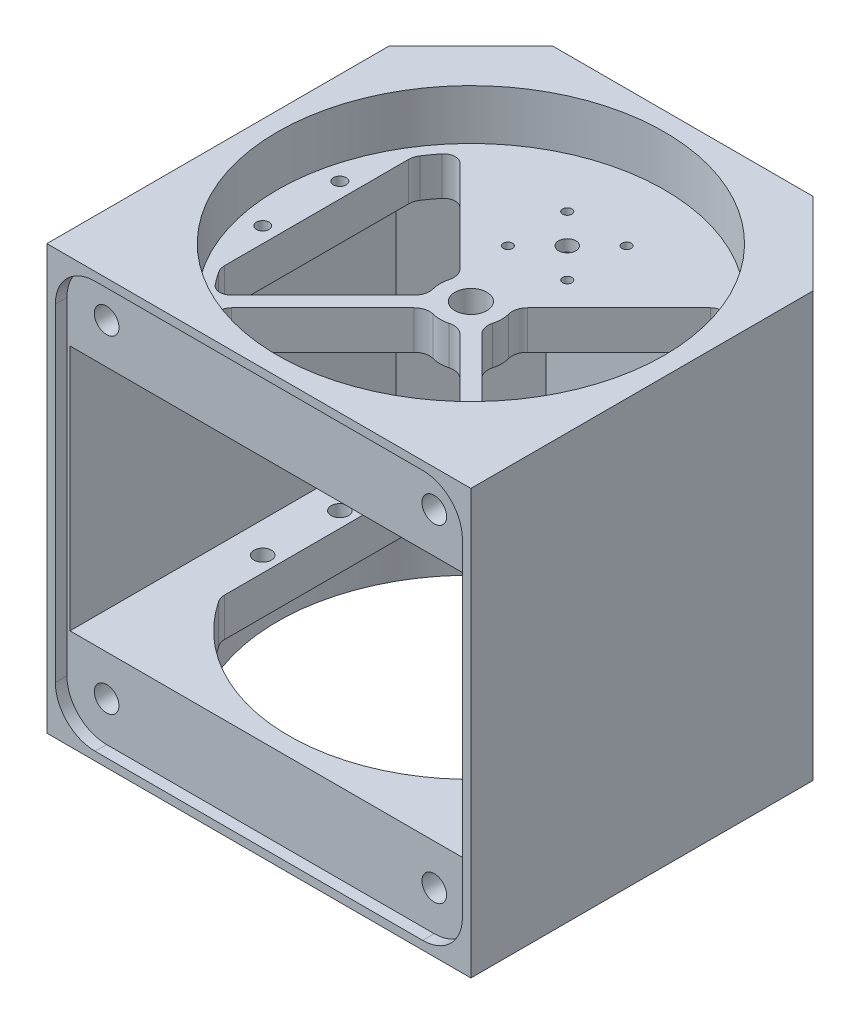
from build123d import *

# Parameters (mm, degrees)
BOSS_EXTRUDE1_DEPTH  = 3
BOSS_EXTRUDE2_REACH  = 125.02
SKETCH3_R            = 50.2
BOSS_EXTRUDE3_DEPTH  = 3
SKETCH4_R            = 50.2
BOSS_EXTRUDE5_DEPTH  = 10
SKETCH5_R            = 47.199999999999996
BOSS_EXTRUDE6_DEPTH  = 2
BOSS_EXTRUDE14_DEPTH = 20
SKETCH12_R           = 47.2
BOSS_EXTRUDE16_DEPTH = 8
SKETCH13_R           = 3.20000000000001
SKETCH13_R_2         = 3.2000000000000037
CUT_EXTRUDE2_DEPTH   = 15
SKETCH14_R           = 4.15
BOSS_EXTRUDE17_DEPTH = 10
FILLET1_R            = 3
FILLET2_R            = 4
SKETCH15_R           = 1.6500000000000017
BOSS_EXTRUDE18_DEPTH = 10
FILLET3_R            = 4
FILLET4_R            = 3
FILLET5_R            = 4
FILLET6_R            = 4
BOSS_EXTRUDE19_DEPTH = 5
SKETCH17_R           = 2.2500000000000004
SKETCH17_R_2         = 1.2000000000000048
SKETCH17_R_3         = 1.200000000000003
CUT_EXTRUDE3_DEPTH   = 154.58710883404248
SKETCH18_R           = 8.2
CUT_EXTRUDE4_DEPTH   = 2
CUT_EXTRUDE5_DEPTH   = 10
SKETCH23_R           = 2.2500000000000027
CUT_EXTRUDE6_DEPTH   = 10


with BuildPart() as part:
    # Sketch1 → Boss-Extrude1 (new body)
    with BuildSketch(Plane.XY):
        Polygon((54.99999999999996, 55), (-55.00000000000002, 54.99999999999997), (-55.00000000000001, -55.00000000000003), (54.99999999999999, -55), align=None)
        with BuildLine():
            Line((52.79999999999999, -42.500000000000014), (52.800000000000004, 42.49999999999998))
            ThreePointArc((52.800000000000004, 42.49999999999998), (49.78319984622145, 49.78319984622142), (42.50000000000001, 52.79999999999998))
            Line((42.50000000000001, 52.79999999999998), (-42.499999999999986, 52.79999999999999))
            ThreePointArc((-42.499999999999986, 52.79999999999999), (-49.78319984622143, 49.78319984622143), (-52.79999999999999, 42.499999999999986))
            Line((-52.79999999999999, 42.499999999999986), (-52.800000000000004, -42.5))
            ThreePointArc((-52.800000000000004, -42.5), (-49.78319984622144, -49.783199846221436), (-42.5, -52.8))
            Line((-42.5, -52.8), (42.499999999999986, -52.80000000000001))
            ThreePointArc((42.499999999999986, -52.80000000000001), (49.78319984622143, -49.78319984622145), (52.79999999999999, -42.500000000000014))
        make_face(mode=Mode.SUBTRACT)
    extrude(amount=-BOSS_EXTRUDE1_DEPTH)

    # Boss-Extrude2: up to this face of the body (flat: up to its plane)
    boss_extrude2_end = Plane(part.part.faces().sort_by_distance((0, 55, -1.5))[0])
    # Sketch2 → Boss-Extrude2 (add, up to the picked face)
    with BuildSketch(Plane.XZ.offset(55.000000000000014), mode=Mode.PRIVATE) as boss_extrude2_sk1:
        Polygon((54.99999999999998, -3), (54.99999999999999, -88.78679656440359), (33.786796564403566, -110), (-33.78679656440356, -110), (-55.00000000000002, -88.78679656440362), (-55.00000000000002, -3), (-52.00000000000002, -3.0000000000000027), (-52.00000000000002, -87.54415587728425), (-32.54415587728427, -107), (32.5441558772843, -107), (51.99999999999998, -87.54415587728431), (51.99999999999998, -3), align=None)
    boss_extrude2_tool1 = split(extrude(boss_extrude2_sk1.sketch, amount=-BOSS_EXTRUDE2_REACH, mode=Mode.PRIVATE), bisect_by=boss_extrude2_end, keep=Keep.BOTH, mode=Mode.PRIVATE)
    add(boss_extrude2_tool1.solids().sort_by(Axis((53.465432, -55, -45.893398), (-2.5e-16, 1, 0)))[0])

    # Sketch3 → Boss-Extrude3 (add)
    with BuildSketch(Plane.XZ.offset(55.000000000000014)):
        Polygon((-52.00000000000002, -3.0000000000000027), (-52.00000000000002, -87.54415587728425), (-32.54415587728427, -107), (32.5441558772843, -107), (51.99999999999998, -87.54415587728431), (51.99999999999998, -3), align=None)
        with Locations((0, -55)):
            Circle(SKETCH3_R, mode=Mode.SUBTRACT)
    boss_extrude3 = extrude(amount=-BOSS_EXTRUDE3_DEPTH)

    # Sketch4 → Boss-Extrude5 (add)
    with BuildSketch(Plane(origin=(1.388e-14, -52.000000000000014, 0), x_dir=(1, 2.7e-16, 0), z_dir=(-2.7e-16, 1, 0))):
        with BuildLine():
            Line((11.235657524150534, 3.000000000000002), (-11.235657524150536, 3.0000000000000027))
            ThreePointArc((-11.235657524150536, 3.0000000000000027), (1.431e-14, 108.2), (11.235657524150534, 3.000000000000002))
        make_face()
        with Locations((-7.6e-16, 55)):
            Circle(SKETCH4_R, mode=Mode.SUBTRACT)
    boss_extrude5 = extrude(amount=BOSS_EXTRUDE5_DEPTH)

    # Sketch5 → Boss-Extrude6 (add)
    with BuildSketch(Plane(origin=(1.121e-14, -42.00000000000001, 0), x_dir=(1, 2.7e-16, 0), z_dir=(-2.7e-16, 1, 0))):
        with BuildLine():
            Line((51.99999999999997, 43.76434247584933), (51.99999999999997, 66.23565752415067))
            ThreePointArc((51.99999999999997, 66.23565752415067), (37.61808075912428, 92.61808075912438), (11.235657524150533, 107.00000000000001))
            Line((11.235657524150533, 107.00000000000001), (-11.235657524150534, 107))
            ThreePointArc((-11.235657524150534, 107), (-37.618080759124375, 92.61808075912428), (-52.00000000000003, 66.23565752415041))
            Line((-52.00000000000003, 66.23565752415041), (-52.00000000000003, 43.7643424758496))
            ThreePointArc((-52.00000000000003, 43.7643424758496), (-37.618080759124375, 17.381919240875717), (-11.235657524150529, 2.9999999999999956))
            Line((-11.235657524150529, 2.9999999999999956), (11.23565752415051, 2.9999999999999956))
            ThreePointArc((11.23565752415051, 2.9999999999999956), (37.618080759124275, 17.38191924087561), (51.99999999999997, 43.76434247584933))
        make_face()
        with Locations(Location((-7.6e-16, 55, 0), (0, 0, 180))):
            Circle(SKETCH5_R, mode=Mode.SUBTRACT)
    boss_extrude6 = extrude(amount=BOSS_EXTRUDE6_DEPTH)

    # Sketch11 → Boss-Extrude14 (add)
    with BuildSketch(Plane(origin=(1.388e-14, -52.000000000000014, 0), x_dir=(1, 2.7e-16, 0), z_dir=(-2.7e-16, 1, 0))):
        with BuildLine():
            Line((-52.00000000000002, 43.76434247584956), (-52.00000000000002, 3.0000000000000027))
            Line((-52.00000000000002, 3.0000000000000027), (-46.47994974842644, 3.000000000000002))
            Line((-46.47994974842644, 3.000000000000002), (-11.235657524150511, 3.0000000000000018))
            ThreePointArc((-11.235657524150511, 3.0000000000000018), (-37.61808075912436, 17.381919240875703), (-52.00000000000002, 43.76434247584956))
        make_face()
        with BuildLine():
            Line((-11.235657524150536, 107), (-32.54415587728427, 107))
            Line((-32.54415587728427, 107), (-52.00000000000003, 87.54415587728425))
            Line((-52.00000000000003, 87.54415587728425), (-52.00000000000002, 66.23565752415044))
            ThreePointArc((-52.00000000000002, 66.23565752415044), (-37.61808075912436, 92.6180807591243), (-11.235657524150536, 107))
        make_face()
        with BuildLine():
            Line((51.99999999999998, 66.23565752415062), (51.99999999999998, 87.54415587728431))
            Line((51.99999999999998, 87.54415587728431), (32.5441558772843, 107))
            Line((32.5441558772843, 107), (11.235657524150536, 107))
            ThreePointArc((11.235657524150536, 107), (37.6180807591243, 92.61808075912435), (51.99999999999998, 66.23565752415062))
        make_face()
        with BuildLine():
            Line((11.235657524150534, 3.000000000000002), (46.47994974842649, 3.0000000000000004))
            Line((46.47994974842649, 3.0000000000000004), (51.99999999999998, 3))
            Line((51.99999999999998, 3), (51.99999999999998, 43.764342475849375))
            ThreePointArc((51.99999999999998, 43.764342475849375), (37.6180807591243, 17.38191924087564), (11.235657524150534, 3.000000000000002))
        make_face()
    boss_extrude14 = extrude(amount=BOSS_EXTRUDE14_DEPTH)

    # Sketch12 → Boss-Extrude16 (add)
    with BuildSketch(Plane(origin=(1.068e-14, -40.00000000000001, 0), x_dir=(1, 2.7e-16, 0), z_dir=(-2.7e-16, 1, 0))):
        with BuildLine():
            Line((51.99999999999997, 43.764342475849375), (51.99999999999997, 66.23565752415062))
            ThreePointArc((51.99999999999997, 66.23565752415062), (37.618080759124304, 92.61808075912435), (11.23565752415058, 106.99999999999999))
            Line((11.23565752415058, 106.99999999999999), (-11.235657524150536, 107))
            ThreePointArc((-11.235657524150536, 107), (-37.61808075912436, 92.6180807591243), (-52.00000000000003, 66.23565752415044))
            Line((-52.00000000000003, 66.23565752415044), (-52.00000000000003, 43.76434247584956))
            ThreePointArc((-52.00000000000003, 43.76434247584956), (-37.61808075912437, 17.381919240875696), (-11.235657524150529, 2.999999999999989))
            Line((-11.235657524150529, 2.999999999999989), (11.235657524150508, 3.0000000000000027))
            ThreePointArc((11.235657524150508, 3.0000000000000027), (37.61808075912429, 17.38191924087564), (51.99999999999997, 43.764342475849375))
        make_face()
        with Locations(Location((-7.6e-16, 55, 0), (0, 0, 180))):
            Circle(SKETCH12_R, mode=Mode.SUBTRACT)
    boss_extrude16 = extrude(amount=BOSS_EXTRUDE16_DEPTH)

    # Mirror2: Boss-Extrude3, Boss-Extrude5, Boss-Extrude6, Boss-Extrude14, Boss-Extrude16 across plane
    add(boss_extrude3.mirror(Plane.ZX))
    add(boss_extrude5.mirror(Plane.ZX))
    add(boss_extrude6.mirror(Plane.ZX))
    add(boss_extrude14.mirror(Plane.ZX))
    add(boss_extrude16.mirror(Plane.ZX))

    # Sketch13 → Cut-Extrude2 (cut)
    with BuildSketch(Plane.XY.offset(-3.000000000000048)):
        with Locations((-42.499999999999986, 42.50000000000001)):
            Circle(SKETCH13_R)
        with Locations((-42.49999999999999, -42.499999999999986)):
            Circle(SKETCH13_R_2)
        with Locations((42.49999999999999, -42.50000000000001)):
            Circle(SKETCH13_R_2)
        with Locations((42.500000000000014, 42.49999999999998)):
            Circle(SKETCH13_R_2)
    extrude(amount=-CUT_EXTRUDE2_DEPTH, mode=Mode.SUBTRACT)

    # Sketch14 → Boss-Extrude17 (add)
    with BuildSketch(Plane(origin=(1.121e-14, 42.00000000000001, 0), x_dir=(1, -2.7e-16, 0), z_dir=(2.7e-16, 1, 0))):
        with BuildLine():
            Line((-34.759678021576725, 86.93125089683014), (-6.891439137424786, 59.06301201267851))
            ThreePointArc((-6.891439137424786, 59.06301201267851), (-7.999999999999999, 54.99999999999995), (-6.891439137424732, 50.936987987321395))
            Line((-6.891439137424732, 50.936987987321395), (-34.759678021576356, 23.06874910316946))
            ThreePointArc((-34.759678021576356, 23.06874910316946), (-33.37544007200486, 21.62455992799478), (-31.93125089683014, 20.240321978423275))
            Line((-31.93125089683014, 20.240321978423275), (-4.063012012678523, 48.108560862575224))
            ThreePointArc((-4.063012012678523, 48.108560862575224), (3.881e-14, 47.00000000000001), (4.06301201267859, 48.10856086257526))
            Line((4.06301201267859, 48.10856086257526), (31.93125089683052, 20.24032197842364))
            ThreePointArc((31.93125089683052, 20.24032197842364), (33.37544007200523, 21.624559927995165), (34.75967802157674, 23.068749103169893))
            Line((34.75967802157674, 23.068749103169893), (6.8914391374247845, 50.936987987321494))
            ThreePointArc((6.8914391374247845, 50.936987987321494), (7.999999999999994, 55.00000000000005), (6.891439137424739, 59.06301201267859))
            Line((6.891439137424739, 59.06301201267859), (34.75967802157636, 86.9312508968305))
            ThreePointArc((34.75967802157636, 86.9312508968305), (33.375440072004835, 88.3754400720052), (31.93125089683011, 89.75967802157672))
            Line((31.93125089683011, 89.75967802157672), (4.063012012678516, 61.89143913742478))
            ThreePointArc((4.063012012678516, 61.89143913742478), (-4.645e-14, 63), (-4.063012012678599, 61.89143913742474))
            Line((-4.063012012678599, 61.89143913742474), (-31.931250896830555, 89.75967802157635))
            ThreePointArc((-31.931250896830555, 89.75967802157635), (-33.375440072005254, 88.37544007200484), (-34.759678021576725, 86.93125089683014))
        make_face()
        with Locations(Location((-7.6e-16, 55, 0), (0, 0, 180))):
            Circle(SKETCH14_R, mode=Mode.SUBTRACT)
    boss_extrude17 = extrude(amount=-BOSS_EXTRUDE17_DEPTH)

    # Fillet1
    # the kernel refuses this fillet: 3 mm, written as the material it adds along each edge
    with BuildSketch(Plane(origin=(-34.759678021576704, 40.000000000000014, -86.93125089683014), x_dir=(-0.6499532804124343, 0, 0.7599741661932433), z_dir=(-2.7e-16, -1, 0))) as fillet1_piece_1:
        with BuildLine():
            CenterArc((3.2430714913870022, -2.998110927308941), FILLET1_R, 87.96659386431453, 96.49532662607197)
            Line((0.25216371595927567, -3.2315004705321977), (0, 0))
            ThreePointArc((0, 0), (1.6747590196221822, 0.02972141033939397), (3.349518039244354, 5e-17))
        make_face()
    extrude(amount=8)
    with BuildSketch(Plane(origin=(-31.931250896830544, 40.000000000000014, -89.75967802157635), x_dir=(0.7599741661932361, 0, -0.6499532804124429), z_dir=(-2.7e-16, -1, 0))) as fillet1_piece_2:
        with BuildLine():
            CenterArc((3.243071491387006, 2.998110927308935), FILLET1_R, 175.53807950961286, 96.49532662607254)
            Line((0.2521637159592789, 3.2315004705322257), (0, 0))
            ThreePointArc((0, 0), (1.674759019622179, -0.02972141033938742), (3.349518039244354, -3e-17))
        make_face()
    extrude(amount=8)
    with BuildSketch(Plane(origin=(31.931250896830118, 40, -89.75967802157672), x_dir=(-0.7599741661932423, 0, -0.6499532804124355), z_dir=(-2.7e-16, -1, 0))) as fillet1_piece_3:
        with BuildLine():
            CenterArc((3.243071491386964, -2.9981109273089364), FILLET1_R, 87.96659386431435, 96.49532662607214)
            Line((0.25216371595923237, -3.2315004705321937), (0, 0))
            ThreePointArc((0, 0), (1.6747590196221533, 0.02972141033940673), (3.3495180392443262, 4e-17))
        make_face()
    extrude(amount=8)
    with BuildSketch(Plane(origin=(34.75967802157638, 40, -86.9312508968305), x_dir=(0.6499532804124455, 0, 0.7599741661932338), z_dir=(-2.7e-16, -1, 0))) as fillet1_piece_4:
        with BuildLine():
            CenterArc((3.243071491386969, 2.9981109273089324), FILLET1_R, 175.53807950961357, 96.49532662607226)
            Line((0.25216371595924175, 3.2315004705321857), (0, 0))
            ThreePointArc((0, 0), (1.6747590196221902, -0.02972141033940014), (3.34951803924434, 1.2e-16))
        make_face()
    extrude(amount=8)
    with BuildSketch(Plane(origin=(34.75967802157676, 40, -23.068749103169893), x_dir=(0.6499532804124305, 0, -0.7599741661932468), z_dir=(-2.7e-16, -1, 0))) as fillet1_piece_5:
        with BuildLine():
            CenterArc((3.243071491386989, -2.9981109273089372), FILLET1_R, 87.96659386431473, 96.49532662607226)
            Line((0.25216371595926346, -3.2315004705322194), (0, 0))
            ThreePointArc((0, 0), (1.6747590196221576, 0.02972141033939562), (3.3495180392443307, 7e-17))
        make_face()
    extrude(amount=8)
    with BuildSketch(Plane(origin=(31.93125089683053, 40, -20.240321978423637), x_dir=(-0.7599741661932353, 0, 0.6499532804124437), z_dir=(-2.7e-16, -1, 0))) as fillet1_piece_6:
        with BuildLine():
            CenterArc((3.2430714913869796, 2.9981109273089372), FILLET1_R, 175.5380795096136, 96.49532662607197)
            Line((0.2521637159592498, 3.2315004705321897), (0, 0))
            ThreePointArc((0, 0), (1.6747590196221802, -0.02972141033940335), (3.349518039244338, -4e-17))
        make_face()
    extrude(amount=8)
    with BuildSketch(Plane(origin=(-31.931250896830132, 40.000000000000014, -20.24032197842327), x_dir=(0.7599741661932465, 0, 0.6499532804124305), z_dir=(-2.7e-16, -1, 0))) as fillet1_piece_7:
        with BuildLine():
            CenterArc((3.2430714913869956, -2.998110927308939), FILLET1_R, 87.96659386431477, 96.49532662607203)
            Line((0.2521637159592676, -3.2315004705322137), (0, 0))
            ThreePointArc((0, 0), (1.6747590196221702, 0.02972141033938877), (3.349518039244335, 1e-17))
        make_face()
    extrude(amount=8)
    with BuildSketch(Plane(origin=(-34.75967802157635, 40.000000000000014, -23.06874910316946), x_dir=(-0.6499532804124424, 0, -0.7599741661932364), z_dir=(-2.7e-16, -1, 0))) as fillet1_piece_8:
        with BuildLine():
            CenterArc((3.24307149138697, 2.9981109273089377), FILLET1_R, 175.53807950961334, 96.49532662607214)
            Line((0.2521637159592439, 3.231500470532203), (0, 0))
            ThreePointArc((0, 0), (1.6747590196221709, -0.02972141033939545), (3.3495180392443236, 3.3e-16))
        make_face()
    extrude(amount=8)
    with BuildSketch(Plane(origin=(-34.75967802157635, 42.000000000000014, -23.06874910316946), x_dir=(-0.64995328041244, 0, -0.7599741661932384), z_dir=(-2.7e-16, -1, 0))) as fillet1_piece_9:
        with BuildLine():
            CenterArc((3.24307149138698, 2.9981109273089377), FILLET1_R, 175.53807950961317, 96.49532662607214)
            Line((0.2521637159592546, 3.2315004705322123), (0, 0))
            ThreePointArc((0, 0), (1.674759019622166, -0.02972141033939515), (3.3495180392443245, -1e-16))
        make_face()
    extrude(amount=2)
    with BuildSketch(Plane(origin=(-31.931250896830132, 42.000000000000014, -20.24032197842327), x_dir=(0.7599741661932475, 0, 0.6499532804124295), z_dir=(-2.7e-16, -1, 0))) as fillet1_piece_10:
        with BuildLine():
            CenterArc((3.2430714913870027, -2.9981109273089372), FILLET1_R, 87.9665938643148, 96.49532662607226)
            Line((0.2521637159592757, -3.2315004705322257), (0, 0))
            ThreePointArc((0, 0), (1.6747590196221758, 0.02972141033938655), (3.349518039244341, 1.9e-16))
        make_face()
    extrude(amount=2)
    with BuildSketch(Plane(origin=(31.93125089683053, 42, -20.240321978423637), x_dir=(-0.7599741661932368, 0, 0.6499532804124419), z_dir=(-2.7e-16, -1, 0))) as fillet1_piece_11:
        with BuildLine():
            CenterArc((3.2430714913869845, 2.9981109273089372), FILLET1_R, 175.5380795096133, 96.49532662607214)
            Line((0.2521637159592583, 3.2315004705322043), (0, 0))
            ThreePointArc((0, 0), (1.6747590196221782, -0.02972141033939944), (3.3495180392443364, 0))
        make_face()
    extrude(amount=2)
    with BuildSketch(Plane(origin=(34.75967802157676, 42, -23.068749103169893), x_dir=(0.6499532804124286, 0, -0.7599741661932481), z_dir=(-2.7e-16, -1, 0))) as fillet1_piece_12:
        with BuildLine():
            CenterArc((3.243071491386993, -2.998110927308937), FILLET1_R, 87.96659386431486, 96.4953266260722)
            Line((0.2521637159592663, -3.2315004705322234), (0, 0))
            ThreePointArc((0, 0), (1.6747590196221551, 0.02972141033939168), (3.349518039244328, 1.2e-16))
        make_face()
    extrude(amount=2)
    with BuildSketch(Plane(origin=(34.75967802157638, 42, -86.9312508968305), x_dir=(0.6499532804124443, 0, 0.7599741661932348), z_dir=(-2.7e-16, -1, 0))) as fillet1_piece_13:
        with BuildLine():
            CenterArc((3.243071491386969, 2.998110927308933), FILLET1_R, 175.53807950961348, 96.49532662607226)
            Line((0.2521637159592423, 3.23150047053219), (0, 0))
            ThreePointArc((0, 0), (1.6747590196221855, -0.02972141033939746), (3.3495180392443356, 1.2e-16))
        make_face()
    extrude(amount=2)
    with BuildSketch(Plane(origin=(31.931250896830118, 42, -89.75967802157672), x_dir=(-0.7599741661932428, 0, -0.649953280412435), z_dir=(-2.7e-16, -1, 0))) as fillet1_piece_14:
        with BuildLine():
            CenterArc((3.2430714913869685, -2.998110927308937), FILLET1_R, 87.96659386431438, 96.49532662607226)
            Line((0.2521637159592425, -3.231500470532201), (0, 0))
            ThreePointArc((0, 0), (1.674759019622156, 0.02972141033940544), (3.349518039244329, -1.1e-16))
        make_face()
    extrude(amount=2)
    with BuildSketch(Plane(origin=(-31.931250896830544, 42.000000000000014, -89.75967802157635), x_dir=(0.759974166193239, 0, -0.6499532804124394), z_dir=(-2.7e-16, -1, 0))) as fillet1_piece_15:
        with BuildLine():
            CenterArc((3.243071491387015, 2.998110927308935), FILLET1_R, 175.53807950961294, 96.4953266260722)
            Line((0.252163715959291, 3.231500470532222), (0, 0))
            ThreePointArc((0, 0), (1.6747590196221724, -0.02972141033938204), (3.3495180392443498, 5e-17))
        make_face()
    extrude(amount=2)
    with BuildSketch(Plane(origin=(-34.759678021576704, 42.000000000000014, -86.93125089683014), x_dir=(-0.649953280412433, 0, 0.7599741661932444), z_dir=(-2.7e-16, -1, 0))) as fillet1_piece_16:
        with BuildLine():
            CenterArc((3.2430714913870027, -2.9981109273089412), FILLET1_R, 87.96659386431465, 96.49532662607191)
            Line((0.25216371595927617, -3.231500470532203), (0, 0))
            ThreePointArc((0, 0), (1.674759019622182, 0.02972141033939672), (3.3495180392443498, 5e-17))
        make_face()
    extrude(amount=2)

    # Fillet2
    fillet2_edges = [part.edges().sort_by_distance(p)[0] for p in [
        (-4.0630120126785885, 37.00000000000001, -61.89143913742474),
        (4.063012012678526, 37.00000000000001, -61.89143913742478),
        (6.89143913742475, 37.00000000000001, -59.06301201267859),
        (6.891439137424796, 37.00000000000001, -50.936987987321494),
        (4.0630120126786, 37.00000000000001, -48.10856086257526),
        (-4.063012012678513, 37.00000000000001, -48.108560862575224),
        (-6.891439137424723, 37.00000000000001, -50.936987987321395),
        (-6.8914391374247765, 37.00000000000001, -59.06301201267851),
    ]]
    fillet(fillet2_edges, radius=FILLET2_R)

    # Sketch15 → Boss-Extrude18 (add)
    # profile 1 of 2: a face of its own
    with BuildSketch(Plane(origin=(1.121e-14, 42.00000000000001, 0), x_dir=(1, -2.7e-16, 0), z_dir=(2.7e-16, 1, 0))):
        with BuildLine():
            Line((-40.00000000000001, 80.05673562138533), (-40.00000000000001, 29.943264378614696))
            ThreePointArc((-40.00000000000001, 29.943264378614696), (-47.20000000000001, 55.00000000000003), (-40.00000000000001, 80.05673562138533))
        make_face()
        with Locations(Location((-44.000000000000014, 65, 0), (0, 0, 180))):
            Circle(SKETCH15_R, mode=Mode.SUBTRACT)
        with Locations(Location((-44.000000000000014, 44.99999999999999, 0), (0, 0, 180))):
            Circle(SKETCH15_R, mode=Mode.SUBTRACT)
    # profile 2 of 2: a face of its own
    with BuildSketch(Plane(origin=(1.121e-14, 42.00000000000001, 0), x_dir=(1, -2.7e-16, 0), z_dir=(2.7e-16, 1, 0))):
        with BuildLine():
            Line((40.00000000000001, 80.05673562138533), (40.00000000000001, 29.943264378614696))
            ThreePointArc((40.00000000000001, 29.943264378614696), (47.199999999999996, 55.00000000000001), (40.00000000000001, 80.05673562138533))
        make_face()
        with Locations(Location((43.999999999999986, 45.00000000000001, 0), (0, 0, 180))):
            Circle(SKETCH15_R, mode=Mode.SUBTRACT)
        with Locations(Location((43.999999999999986, 64.99999999999999, 0), (0, 0, 180))):
            Circle(SKETCH15_R, mode=Mode.SUBTRACT)
    boss_extrude18 = extrude(amount=-BOSS_EXTRUDE18_DEPTH)

    # Fillet3
    fillet3_edges = [part.edges().sort_by_distance(p)[0] for p in [
        (-39.999999999999986, 37.00000000000002, -29.9432643786147),
        (-39.999999999999986, 37.00000000000002, -80.05673562138533),
        (40.00000000000003, 36.99999999999999, -80.05673562138533),
        (40.00000000000003, 36.99999999999999, -29.943264378614693),
    ]]
    fillet(fillet3_edges, radius=FILLET3_R)

    # Mirror8: Boss-Extrude17 across plane
    add(boss_extrude17.mirror(Plane.ZX))

    # Fillet4
    # the kernel refuses this fillet: 3 mm, written as the material it adds along each edge
    with BuildSketch(Plane(origin=(-31.931250896830544, -42.000000000000014, -89.75967802157635), x_dir=(0.7071067811865519, 0, 0.7071067811865431), z_dir=(-2.7e-16, 1, 0))) as fillet4_piece_1:
        with BuildLine():
            CenterArc((3.2413240860327965, 3.0000000000000018), FILLET4_R, 173.5046733739275, 96.4953266260726)
            ThreePointArc((0.26058082839913094, 3.339366515837124), (0.10065908177263826, 1.671995480046251), (0, 0))
            Line((0, 0), (3.2413240860328005, -4e-17))
        make_face()
    extrude(amount=10)
    with BuildSketch(Plane(origin=(-34.759678021576704, -42.000000000000014, -86.93125089683014), x_dir=(0.7071067811865498, 0, 0.7071067811865454), z_dir=(-2.7e-16, 1, 0))) as fillet4_piece_2:
        with BuildLine():
            CenterArc((3.2413240860327814, -3.0000000000000044), FILLET4_R, 90.0000000000002, 96.49532662607226)
            ThreePointArc((0.2605808283991172, -3.339366515837124), (0.10065908177263523, -1.6719954800462546), (0, 0))
            Line((0, 0), (3.241324086032771, -3e-17))
        make_face()
    extrude(amount=10)
    with BuildSketch(Plane(origin=(-34.75967802157635, -42.000000000000014, -23.06874910316946), x_dir=(0.7071067811865437, 0, -0.7071067811865513), z_dir=(-2.7e-16, 1, 0))) as fillet4_piece_3:
        with BuildLine():
            CenterArc((3.241324086032779, 2.999999999999999), FILLET4_R, 173.50467337392803, 96.49532662607191)
            ThreePointArc((0.26058082839910807, 3.3393665158370944), (0.10065908177262935, 1.6719954800462438), (0, 0))
            Line((0, 0), (3.241324086032778, 7e-17))
        make_face()
    extrude(amount=10)
    with BuildSketch(Plane(origin=(-31.931250896830132, -42.000000000000014, -20.24032197842327), x_dir=(0.7071067811865437, 0, -0.7071067811865513), z_dir=(-2.7e-16, 1, 0))) as fillet4_piece_4:
        with BuildLine():
            CenterArc((3.2413240860327943, -3.0000000000000018), FILLET4_R, 90.00000000000003, 96.49532662607203)
            ThreePointArc((0.2605808283991248, -3.3393665158370998), (0.10065908177263895, -1.6719954800462373), (0, 0))
            Line((0, 0), (3.241324086032793, 5e-17))
        make_face()
    extrude(amount=10)
    with BuildSketch(Plane(origin=(31.93125089683053, -42, -20.240321978423637), x_dir=(-0.7071067811865508, 0, -0.7071067811865442), z_dir=(-2.7e-16, 1, 0))) as fillet4_piece_5:
        with BuildLine():
            CenterArc((3.241324086032764, 2.999999999999999), FILLET4_R, 173.50467337392772, 96.49532662607231)
            ThreePointArc((0.26058082839909547, 3.3393665158371095), (0.10065908177261798, 1.6719954800462538), (0, 0))
            Line((0, 0), (3.2413240860327655, 4e-17))
        make_face()
    extrude(amount=10)
    with BuildSketch(Plane(origin=(34.75967802157676, -42, -23.068749103169893), x_dir=(-0.7071067811865536, 0, -0.7071067811865415), z_dir=(-2.7e-16, 1, 0))) as fillet4_piece_6:
        with BuildLine():
            CenterArc((3.241324086032785, -3.0000000000000018), FILLET4_R, 89.99999999999984, 96.4953266260722)
            ThreePointArc((0.26058082839911434, -3.3393665158371006), (0.10065908177263108, -1.67199548004623), (0, 0))
            Line((0, 0), (3.241324086032793, -9e-17))
        make_face()
    extrude(amount=10)
    with BuildSketch(Plane(origin=(34.75967802157638, -42, -86.9312508968305), x_dir=(-0.7071067811865432, 0, 0.707106781186552), z_dir=(-2.7e-16, 1, 0))) as fillet4_piece_7:
        with BuildLine():
            CenterArc((3.2413240860327646, 2.9999999999999996), FILLET4_R, 173.50467337392766, 96.49532662607226)
            ThreePointArc((0.2605808283990983, 3.339366515837112), (0.10065908177262066, 1.671995480046264), (0, 0))
            Line((0, 0), (3.241324086032761, -5e-17))
        make_face()
    extrude(amount=10)
    with BuildSketch(Plane(origin=(31.931250896830118, -42, -89.75967802157672), x_dir=(-0.7071067811865415, 0, 0.7071067811865536), z_dir=(-2.7e-16, 1, 0))) as fillet4_piece_8:
        with BuildLine():
            CenterArc((3.241324086032765, -3.0000000000000018), FILLET4_R, 89.99999999999984, 96.49532662607214)
            ThreePointArc((0.2605808283990917, -3.339366515837098), (0.10065908177260852, -1.6719954800462276), (0, 0))
            Line((0, 0), (3.241324086032773, -7e-17))
        make_face()
    extrude(amount=10)

    # Fillet5
    fillet5_edges = [part.edges().sort_by_distance(p)[0] for p in [
        (-6.8914391374247765, -37.00000000000001, -59.06301201267851),
        (-6.891439137424723, -37.00000000000001, -50.936987987321395),
        (-4.063012012678513, -37.00000000000001, -48.108560862575224),
        (4.0630120126786, -37.00000000000001, -48.10856086257526),
        (6.891439137424796, -37.00000000000001, -50.936987987321494),
        (6.89143913742475, -37.00000000000001, -59.06301201267859),
        (4.063012012678526, -37.00000000000001, -61.89143913742478),
        (-4.0630120126785885, -37.00000000000001, -61.89143913742474),
    ]]
    fillet(fillet5_edges, radius=FILLET5_R)

    # Mirror9: Boss-Extrude18 across plane
    add(boss_extrude18.mirror(Plane.ZX))

    # Fillet6
    fillet6_edges = [part.edges().sort_by_distance(p)[0] for p in [
        (-39.999999999999986, -37.00000000000002, -80.05673562138533),
        (-39.999999999999986, -37.00000000000002, -29.9432643786147),
        (40.00000000000003, -36.99999999999999, -29.943264378614693),
        (40.00000000000003, -36.99999999999999, -80.05673562138533),
    ]]
    fillet(fillet6_edges, radius=FILLET6_R)

    # Sketch16 → Boss-Extrude19 (add)
    with BuildSketch(Plane(origin=(1.121e-14, 42.00000000000001, 0), x_dir=(1, -2.7e-16, 0), z_dir=(2.7e-16, 1, 0))):
        with BuildLine():
            Line((29.63928865557307, 87.46771578031965), (5.934255665976376, 63.76268279072267))
            ThreePointArc((5.934255665976376, 63.76268279072267), (4.141104721640273, 62.72740661031258), (2.0705523608201073, 62.72740661031256))
            ThreePointArc((2.0705523608201073, 62.72740661031256), (-5.001e-14, 63), (-2.070552360820204, 62.727406610312535))
            ThreePointArc((-2.070552360820204, 62.727406610312535), (-4.141104721640372, 62.72740661031253), (-5.934255665976486, 63.7626827907226))
            Line((-5.934255665976486, 63.7626827907226), (-29.63928865557346, 87.46771578031928))
            ThreePointArc((-29.63928865557346, 87.46771578031928), (-30.51315025748068, 89.75899233456124), (-29.38570371780663, 91.93670825898384))
            ThreePointArc((-29.38570371780663, 91.93670825898384), (-2.9132e-13, 102.19999999999999), (29.385703717806177, 91.9367082589842))
            ThreePointArc((29.385703717806177, 91.9367082589842), (30.51315025748025, 89.75899233456163), (29.63928865557307, 87.46771578031965))
        make_face()
    extrude(amount=-BOSS_EXTRUDE19_DEPTH)

    # Sketch17 → Cut-Extrude3 (cut, through all)
    with BuildSketch(Plane.XZ.offset(-37.000000000000014)):
        with Locations((3.06e-15, -80)):
            Circle(SKETCH17_R)
        with Locations((7.699999999999999, -72.3)):
            Circle(SKETCH17_R_2)
        with Locations((7.700000000000001, -87.7)):
            Circle(SKETCH17_R_3)
        with Locations((-7.699999999999995, -87.7)):
            Circle(SKETCH17_R_3)
        with Locations((-7.699999999999997, -72.3)):
            Circle(SKETCH17_R_3)
    extrude(amount=-CUT_EXTRUDE3_DEPTH, mode=Mode.SUBTRACT)

    # Sketch18 → Cut-Extrude4 (cut)
    with BuildSketch(Plane.XZ.offset(-37.000000000000014)):
        with Locations((3.06e-15, -80)):
            Circle(SKETCH18_R)
    extrude(amount=-CUT_EXTRUDE4_DEPTH, mode=Mode.SUBTRACT)

    # Sketch20 → Cut-Extrude5 (cut)
    with BuildSketch(Plane.XZ.offset(42.00000000000001)):
        with BuildLine():
            Line((40.00000000000001, -78.87969849055887), (40.00000000000001, -31.12030150944113))
            ThreePointArc((40.00000000000001, -31.12030150944113), (39.82970843102536, -29.96560097106188), (39.333333333333336, -28.909218315870863))
            ThreePointArc((39.333333333333336, -28.909218315870863), (38.17058997350532, -27.23588537203942), (36.93670825898421, -25.61429628219384))
            ThreePointArc((36.93670825898421, -25.61429628219384), (2.8824e-13, -7.80000000000021), (-36.936708258983856, -25.614296282193393))
            ThreePointArc((-36.936708258983856, -25.614296282193393), (-38.17058997350513, -27.23588537203917), (-39.33333333333332, -28.90921831587086))
            ThreePointArc((-39.33333333333332, -28.90921831587086), (-39.82970843102534, -29.965600971061868), (-40.00000000000001, -31.120301509441116))
            Line((-40.00000000000001, -31.120301509441116), (-40.00000000000001, -78.87969849055888))
            ThreePointArc((-40.00000000000001, -78.87969849055888), (-39.82970843102536, -80.03439902893813), (-39.333333333333336, -81.09078168412914))
            ThreePointArc((-39.333333333333336, -81.09078168412914), (-38.170589973505315, -82.7641146279606), (-36.9367082589842, -84.3857037178062))
            ThreePointArc((-36.9367082589842, -84.3857037178062), (-2.5162e-13, -102.19999999999987), (36.93670825898387, -84.38570371780659))
            ThreePointArc((36.93670825898387, -84.38570371780659), (38.17058997350515, -82.76411462796081), (39.333333333333336, -81.09078168412914))
            ThreePointArc((39.333333333333336, -81.09078168412914), (39.82970843102536, -80.03439902893813), (40.00000000000001, -78.87969849055887))
        make_face()
    extrude(amount=-CUT_EXTRUDE5_DEPTH, mode=Mode.SUBTRACT)

    # Sketch23 → Cut-Extrude6 (cut)
    with BuildSketch(Plane.XZ.offset(42.00000000000001)):
        with Locations((43.999999999999986, -64.99999999999999)):
            Circle(SKETCH23_R)
        with Locations((43.999999999999986, -45.00000000000001)):
            Circle(SKETCH23_R)
        with Locations((-44.000000000000014, -65)):
            Circle(SKETCH23_R)
        with Locations((-44.000000000000014, -44.99999999999999)):
            Circle(SKETCH23_R)
    extrude(amount=-CUT_EXTRUDE6_DEPTH, mode=Mode.SUBTRACT)


solid = part.part
